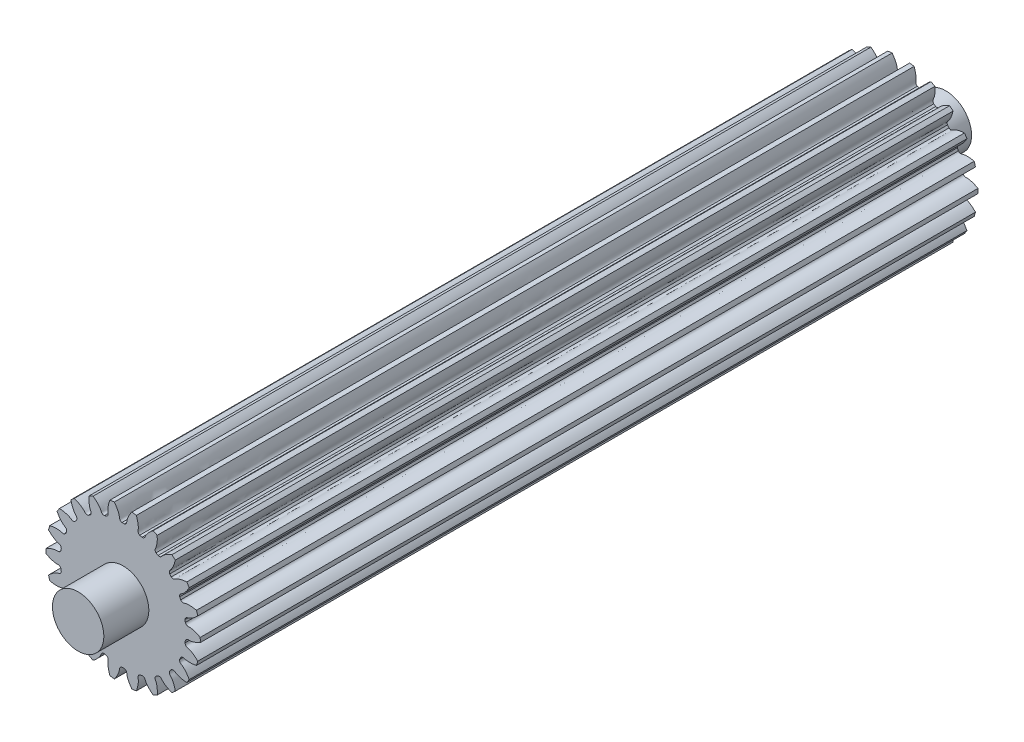
from build123d import *
from build123d.topology import SkipClean

# Parameters (mm, degrees)
SKETCH_1_R               = 12
EXTRUDE_1_DEPTH          = 30
CUT_EXTRUDE_1_DEPTH      = 35.467375879
PATTERN_CIRCULAR_1_COUNT = 22
EXTRUDE_START            = 91
EXTRUDE_2_DEPTH          = 91
SKETCH_19_R              = 4
EXTRUDE_3_DEPTH          = 7
EXTRUDE_START_2          = 7
SKETCH_20_R              = 4
EXTRUDE_4_DEPTH          = 7


with BuildPart() as part:
    # 草图1 → 凸台-拉伸1 (new body)
    with BuildSketch(Plane.XY):
        Circle(SKETCH_1_R)
    extrude(amount=EXTRUDE_1_DEPTH)

    # 草图2 → 切除-拉伸1 (cut, through all)
    with BuildSketch(Plane.XY):
        with BuildLine():
            ThreePointArc((0.185665431, 9.748232063), (0, 9.75), (-0.185665431, 9.748232063))
            add(Edge.make_bspline(
                [(-0.185665431, 9.748232063), (-0.588158706, 9.876186429), (-0.548347264, 10.151774696), (-0.599584047, 10.42157039), (-0.60596118, 10.451918903), (-0.613876897, 10.486162213), (-0.623483721, 10.524250431), (-0.634939934, 10.566127653), (-0.648399943, 10.611733662), (-0.664017171, 10.661003439), (-0.681942991, 10.713867378), (-0.70232689, 10.77025128), (-0.72531626, 10.830076418), (-0.751056303, 10.893259589), (-0.779689902, 10.959713172), (-0.811357505, 11.029345185), (-0.846197011, 11.10205935), (-0.884343649, 11.177755162), (-0.925929868, 11.25632795), (-0.971085225, 11.337668957), (-1.019936271, 11.421665408), (-1.072606448, 11.508200591), (-1.129215979, 11.597153935), (-1.189881763, 11.688401095), (-1.254717274, 11.781814033), (-1.323832459, 11.877261111), (-1.397333644, 11.974607178), (-1.475323431, 12.073713662), (-1.557900608, 12.174438668), (-1.64516006, 12.276637076), (-1.737192673, 12.380160638), (-1.834085256, 12.484858081), (-1.935920447, 12.590575215), (-2.042776642, 12.697155033), (-2.154727905, 12.804437827), (-2.271843904, 12.912261294), (-2.394189822, 13.020460649), (-2.521826308, 13.128868741), (-2.654809363, 13.237316171), (-2.841488127, 13.383435539), (-2.986445715, 13.489968103), (-3.085558798, 13.559868128)],
                knots=[0, 0, 0, 0, 0.157021319, 0.162530984, 0.168888289, 0.176093235, 0.184145822, 0.19304605, 0.202793918, 0.213389427, 0.224832576, 0.237123367, 0.250261798, 0.264247869, 0.279081582, 0.294762935, 0.311291928, 0.328668563, 0.346892838, 0.365964754, 0.38588431, 0.406651508, 0.428266346, 0.450728824, 0.474038944, 0.498196704, 0.523202104, 0.549055146, 0.575755828, 0.603304151, 0.631700114, 0.660943719, 0.691034964, 0.721973849, 0.753760376, 0.786394543, 0.819876351, 0.854205799, 0.889382888, 0.925407618, 1, 1, 1, 1], degree=3))
            ThreePointArc((-3.085558798, 13.559868128), (0, 13.906498364), (3.085558798, 13.559868128))
            add(Edge.make_bspline(
                [(0.185665431, 9.748232063), (0.588158706, 9.876186429), (0.548347264, 10.151774696), (0.599584047, 10.42157039), (0.60596118, 10.451918903), (0.613876897, 10.486162213), (0.623483721, 10.524250431), (0.634939934, 10.566127653), (0.648399943, 10.611733662), (0.664017171, 10.661003439), (0.681942991, 10.713867378), (0.70232689, 10.77025128), (0.72531626, 10.830076418), (0.751056303, 10.893259589), (0.779689902, 10.959713172), (0.811357505, 11.029345185), (0.846197011, 11.10205935), (0.884343649, 11.177755162), (0.925929868, 11.25632795), (0.971085225, 11.337668957), (1.019936271, 11.421665408), (1.072606448, 11.508200591), (1.129215979, 11.597153935), (1.189881763, 11.688401095), (1.254717274, 11.781814033), (1.323832459, 11.877261111), (1.397333644, 11.974607178), (1.475323431, 12.073713662), (1.557900608, 12.174438668), (1.64516006, 12.276637076), (1.737192673, 12.380160638), (1.834085256, 12.484858081), (1.935920447, 12.590575215), (2.042776642, 12.697155033), (2.154727905, 12.804437827), (2.271843904, 12.912261294), (2.394189822, 13.020460649), (2.521826308, 13.128868741), (2.654809363, 13.237316171), (2.841488127, 13.383435539), (2.986445715, 13.489968103), (3.085558798, 13.559868128)],
                knots=[0, 0, 0, 0, 0.157021319, 0.162530984, 0.168888289, 0.176093235, 0.184145822, 0.19304605, 0.202793918, 0.213389427, 0.224832576, 0.237123367, 0.250261798, 0.264247869, 0.279081582, 0.294762935, 0.311291928, 0.328668563, 0.346892838, 0.365964754, 0.38588431, 0.406651508, 0.428266346, 0.450728824, 0.474038944, 0.498196704, 0.523202104, 0.549055146, 0.575755828, 0.603304151, 0.631700114, 0.660943719, 0.691034964, 0.721973849, 0.753760376, 0.786394543, 0.819876351, 0.854205799, 0.889382888, 0.925407618, 1, 1, 1, 1], degree=3))
        make_face()
    cut_extrude_1 = extrude(amount=CUT_EXTRUDE_1_DEPTH, mode=Mode.SUBTRACT)

    # 阵列(圆周)1: 切除-拉伸1 ×22 about axis
    pattern_circular_1_axis = Axis((0, 0, -1.5), (0, 0, 1))
    for i in range(1, PATTERN_CIRCULAR_1_COUNT):
        add(cut_extrude_1.rotate(pattern_circular_1_axis, i * 360 / PATTERN_CIRCULAR_1_COUNT), mode=Mode.SUBTRACT)

    # 草图4 → 凸台-拉伸2 (add)
    with BuildSketch(Plane(origin=(0, 0, 0), x_dir=(-1, 0, 0), z_dir=(0, 0, -1)).offset(EXTRUDE_START)):
        with BuildLine():
            ThreePointArc((2.924539021, 9.301052173), (2.746892429, 9.355056493), (2.568249667, 9.405668166))
            add(Edge.make_bspline(
                [(2.568249667, 9.405668166), (2.218109108, 9.641834941), (2.333950094, 9.895043767), (2.361944393, 10.180005258), (2.365849304, 10.238460497), (2.368085913, 10.32113962), (2.366834845, 10.420382901), (2.360772595, 10.536017252), (2.34858845, 10.667790208), (2.32898426, 10.815370787), (2.300679804, 10.978350119), (2.26241667, 11.156242389), (2.212962422, 11.348485973), (2.151114634, 11.554444777), (2.096274933, 11.713680077), (2.062581682, 11.80433527), (2.055688884, 11.822611522)],
                knots=[0, 0, 0, 0, 0.157021319, 0.162530984, 0.176093235, 0.19304605, 0.213389427, 0.237123367, 0.264247869, 0.294762935, 0.328668563, 0.365964754, 0.406651508, 0.450728824, 0.498196704, 0.510209942, 0.510209942, 0.510209942, 0.510209942], degree=3))
            ThreePointArc((2.055688884, 11.822611522), (1.707778059, 11.877857303), (1.358395532, 11.922867171))
            add(Edge.make_bspline(
                [(1.358395532, 11.922867171), (1.300155371, 11.845656586), (1.201946581, 11.708817962), (1.073915974, 11.512256119), (0.972303664, 11.341732625), (0.885472389, 11.181826213), (0.812397844, 11.033422979), (0.752009469, 10.897343589), (0.703194045, 10.774341044), (0.670055832, 10.680054419), (0.644027119, 10.597938124), (0.627360159, 10.539619361), (0.611348785, 10.476138997), (0.60176986, 10.433080149), (0.548347264, 10.151774696), (0.588158706, 9.876186429), (0.185665431, 9.748232063)],
                knots=[0.489790058, 0.489790058, 0.489790058, 0.489790058, 0.549271176, 0.593348492, 0.634035246, 0.671331437, 0.705237065, 0.735752131, 0.762876633, 0.786610573, 0.797206082, 0.815854178, 0.823906765, 0.837469016, 0.842978681, 1, 1, 1, 1], degree=3))
            ThreePointArc((0.185665431, 9.748232063), (0, 9.75), (-0.185665431, 9.748232063))
            add(Edge.make_bspline(
                [(-0.185665431, 9.748232063), (-0.588158706, 9.876186429), (-0.548347264, 10.151774696), (-0.60176986, 10.433080149), (-0.61449187, 10.490267681), (-0.635639261, 10.570227844), (-0.664799714, 10.665098608), (-0.703194362, 10.774341023), (-0.752009695, 10.897343577), (-0.812398032, 11.033422968), (-0.885472542, 11.181826205), (-0.972303795, 11.341732617), (-1.073916075, 11.512256114), (-1.191283893, 11.692447604), (-1.288763969, 11.829782626), (-1.346632927, 11.907273161), (-1.358395532, 11.922867171)],
                knots=[0, 0, 0, 0, 0.157021319, 0.162530984, 0.176093235, 0.19304605, 0.213389427, 0.237123367, 0.264247869, 0.294762935, 0.328668563, 0.365964754, 0.406651508, 0.450728824, 0.498196704, 0.510209942, 0.510209942, 0.510209942, 0.510209942], degree=3))
            ThreePointArc((-1.358395532, 11.922867171), (-1.707778059, 11.877857303), (-2.055688884, 11.822611522))
            add(Edge.make_bspline(
                [(-2.055688884, 11.822611522), (-2.089817174, 11.732120359), (-2.145495923, 11.573156047), (-2.21296252, 11.34848595), (-2.262416797, 11.156242359), (-2.300679954, 10.978350084), (-2.328984444, 10.815370745), (-2.348588671, 10.667790156), (-2.360772906, 10.536017183), (-2.366005176, 10.436213716), (-2.36784471, 10.350090571), (-2.367406247, 10.289438503), (-2.364884562, 10.224018615), (-2.361944393, 10.180005258), (-2.333950094, 9.895043767), (-2.218109108, 9.641834941), (-2.568249667, 9.405668166)],
                knots=[0.489790058, 0.489790058, 0.489790058, 0.489790058, 0.549271176, 0.593348492, 0.634035246, 0.671331437, 0.705237065, 0.735752131, 0.762876633, 0.786610573, 0.797206082, 0.815854178, 0.823906765, 0.837469016, 0.842978681, 1, 1, 1, 1], degree=3))
            ThreePointArc((-2.568249667, 9.405668166), (-2.746892429, 9.355056493), (-2.924539021, 9.301052173))
            add(Edge.make_bspline(
                [(-2.924539021, 9.301052173), (-3.3467774, 9.310428028), (-3.386220788, 9.586069213), (-3.516732299, 9.840928935), (-3.545050567, 9.892215766), (-3.587868721, 9.962979072), (-3.642576155, 10.045791454), (-3.710192695, 10.139791761), (-3.791684488, 10.244058979), (-3.887964667, 10.357612838), (-3.999889169, 10.479417233), (-4.128253989, 10.608383121), (-4.273792278, 10.74337173), (-4.437171685, 10.883197863), (-4.569394878, 10.987506541), (-4.646751344, 11.045554595), (-4.662430821, 11.057203029)],
                knots=[0, 0, 0, 0, 0.157021319, 0.162530984, 0.176093235, 0.19304605, 0.213389427, 0.237123367, 0.264247869, 0.294762935, 0.328668563, 0.365964754, 0.406651508, 0.450728824, 0.498196704, 0.510209942, 0.510209942, 0.510209942, 0.510209942], degree=3))
            ThreePointArc((-4.662430821, 11.057203029), (-4.984980156, 10.915583944), (-5.303233613, 10.7645582))
            add(Edge.make_bspline(
                [(-5.303233613, 10.7645582), (-5.310485161, 10.668117515), (-5.319123107, 10.499905858), (-5.320559952, 10.265328941), (-5.313849705, 10.066939687), (-5.300444889, 9.885473322), (-5.281686262, 9.721121495), (-5.258918124, 9.573995807), (-5.233484075, 9.44412787), (-5.210386516, 9.346893044), (-5.187887842, 9.263740235), (-5.170379477, 9.205668531), (-5.149529026, 9.143609049), (-5.134307959, 9.102206883), (-5.027164697, 8.83667524), (-4.844678915, 8.626359328), (-5.114100451, 8.301112972)],
                knots=[0.489790058, 0.489790058, 0.489790058, 0.489790058, 0.549271176, 0.593348492, 0.634035246, 0.671331437, 0.705237065, 0.735752131, 0.762876633, 0.786610573, 0.797206082, 0.815854178, 0.823906765, 0.837469016, 0.842978681, 1, 1, 1, 1], degree=3))
            ThreePointArc((-5.114100451, 8.301112972), (-5.27124797, 8.202221945), (-5.426483851, 8.100356351))
            add(Edge.make_bspline(
                [(-5.426483851, 8.100356351), (-5.834260094, 7.99039412), (-5.949762843, 8.243757414), (-6.146790001, 8.451524185), (-6.188410351, 8.49275536), (-6.249430396, 8.548588987), (-6.325252738, 8.612634021), (-6.41661328, 8.683776874), (-6.524179553, 8.760861647), (-6.648551527, 8.842690515), (-6.790258564, 8.928028199), (-6.949757596, 9.015605514), (-7.127431248, 9.104123262), (-7.323586215, 9.192256156), (-7.479840591, 9.255088021), (-7.570417602, 9.288990887), (-7.588743694, 9.295750058)],
                knots=[0, 0, 0, 0, 0.157021319, 0.162530984, 0.176093235, 0.19304605, 0.213389427, 0.237123367, 0.264247869, 0.294762935, 0.328668563, 0.365964754, 0.406651508, 0.450728824, 0.498196704, 0.510209942, 0.510209942, 0.510209942, 0.510209942], degree=3))
            ThreePointArc((-7.588743694, 9.295750058), (-7.858328807, 9.068994892), (-8.121141894, 8.834424392))
            add(Edge.make_bspline(
                [(-8.121141894, 8.834424392), (-8.100929222, 8.739847235), (-8.061826571, 8.576015742), (-7.997117259, 8.350536032), (-7.934786112, 8.162073431), (-7.870799303, 7.991734302), (-7.806497272, 7.839324794), (-7.743201307, 7.704573257), (-7.68220949, 7.587131484), (-7.632653327, 7.500342686), (-7.587639155, 7.426896759), (-7.554479312, 7.376110043), (-7.516989274, 7.322438657), (-7.49072043, 7.287001839), (-7.313108313, 7.06241184), (-7.078761648, 6.912027385), (-7.245637231, 6.524050974)],
                knots=[0.489790058, 0.489790058, 0.489790058, 0.489790058, 0.549271176, 0.593348492, 0.634035246, 0.671331437, 0.705237065, 0.735752131, 0.762876633, 0.786610573, 0.797206082, 0.815854178, 0.823906765, 0.837469016, 0.842978681, 1, 1, 1, 1], degree=3))
            ThreePointArc((-7.245637231, 6.524050974), (-7.36855835, 6.384892156), (-7.488807233, 6.243417832))
            add(Edge.make_bspline(
                [(-7.488807233, 6.243417832), (-7.849085732, 6.023026001), (-8.031290497, 6.233585417), (-8.278871334, 6.377427208), (-8.330421932, 6.405262424), (-8.404700387, 6.441643063), (-8.495494963, 6.481732201), (-8.603198018, 6.52425403), (-8.728124391, 6.567911406), (-8.870512283, 6.611385996), (-9.030521594, 6.653343419), (-9.208233175, 6.692437167), (-9.403648127, 6.727312872), (-9.616687345, 6.756612524), (-9.784314102, 6.772877312), (-9.88077365, 6.77988838), (-9.900261685, 6.781210701)],
                knots=[0, 0, 0, 0, 0.157021319, 0.162530984, 0.176093235, 0.19304605, 0.213389427, 0.237123367, 0.264247869, 0.294762935, 0.328668563, 0.365964754, 0.406651508, 0.450728824, 0.498196704, 0.510209942, 0.510209942, 0.510209942, 0.510209942], degree=3))
            ThreePointArc((-9.900261685, 6.781210701), (-10.095042394, 6.487689809), (-10.281123557, 6.188578059))
            add(Edge.make_bspline(
                [(-10.281123557, 6.188578059), (-10.235084176, 6.103526509), (-10.151408791, 5.957347833), (-10.025795686, 5.759232356), (-9.912893339, 5.595964528), (-9.803508366, 5.450552498), (-9.698872299, 5.322432622), (-9.60017637, 5.210972003), (-9.508567979, 5.115470827), (-9.43656796, 5.046159169), (-9.372685068, 4.988370276), (-9.326560161, 4.948982987), (-9.275467756, 4.908047833), (-9.240279279, 4.881447244), (-9.006587387, 4.715993833), (-8.739365211, 4.637724091), (-8.790175575, 4.218449166)],
                knots=[0.489790058, 0.489790058, 0.489790058, 0.489790058, 0.549271176, 0.593348492, 0.634035246, 0.671331437, 0.705237065, 0.735752131, 0.762876633, 0.786610573, 0.797206082, 0.815854178, 0.823906765, 0.837469016, 0.842978681, 1, 1, 1, 1], degree=3))
            ThreePointArc((-8.790175575, 4.218449166), (-8.868911955, 4.050296377), (-8.94443199, 3.880674732))
            add(Edge.make_bspline(
                [(-8.94443199, 3.880674732), (-9.228025124, 3.567708136), (-9.462170759, 3.718405401), (-9.740247748, 3.786669007), (-9.797552271, 3.798853219), (-9.879071537, 3.812833528), (-9.97748271, 3.825718986), (-10.092802818, 3.836174925), (-10.2249685, 3.842868044), (-10.373836889, 3.844466303), (-10.53918547, 3.839644323), (-10.720712465, 3.827087362), (-10.91803736, 3.805495601), (-11.130701659, 3.773588328), (-11.296120675, 3.741968363), (-11.390648179, 3.721519639), (-11.409719353, 3.717297982)],
                knots=[0, 0, 0, 0, 0.157021319, 0.162530984, 0.176093235, 0.19304605, 0.213389427, 0.237123367, 0.264247869, 0.294762935, 0.328668563, 0.365964754, 0.406651508, 0.450728824, 0.498196704, 0.510209942, 0.510209942, 0.510209942, 0.510209942], degree=3))
            ThreePointArc((-11.409719353, 3.717297982), (-11.513915683, 3.380790682), (-11.608189734, 3.041369937))
            add(Edge.make_bspline(
                [(-11.608189734, 3.041369937), (-11.540053481, 2.972734366), (-11.418584245, 2.856051033), (-11.242243773, 2.701349926), (-11.087916901, 2.576503859), (-10.941995486, 2.467799346), (-10.805502374, 2.374348612), (-10.679402238, 2.295208787), (-10.564598841, 2.229385146), (-10.475987977, 2.183165848), (-10.398411779, 2.145715701), (-10.343058573, 2.120918762), (-10.282503004, 2.096036163), (-10.241245656, 2.080426825), (-9.970406315, 1.987514054), (-9.69195738, 1.987699973), (-9.62258617, 1.571093695)],
                knots=[0.489790058, 0.489790058, 0.489790058, 0.489790058, 0.549271176, 0.593348492, 0.634035246, 0.671331437, 0.705237065, 0.735752131, 0.762876633, 0.786610573, 0.797206082, 0.815854178, 0.823906765, 0.837469016, 0.842978681, 1, 1, 1, 1], degree=3))
            ThreePointArc((-9.62258617, 1.571093695), (-9.650759058, 1.387569673), (-9.675432062, 1.203542444))
            add(Edge.make_bspline(
                [(-9.675432062, 1.203542444), (-9.859364802, 0.823355776), (-10.126482219, 0.901982294), (-10.412527217, 0.889137403), (-10.470943193, 0.88468352), (-10.553099064, 0.875130897), (-10.651154146, 0.859768772), (-10.764748758, 0.837311742), (-10.893446471, 0.806498368), (-11.036734926, 0.766090814), (-11.194027219, 0.71488008), (-11.36466339, 0.651689699), (-11.547912138, 0.575379709), (-11.742972721, 0.484850449), (-11.892782731, 0.407907392), (-11.977720136, 0.361655509), (-11.994829415, 0.352231889)],
                knots=[0, 0, 0, 0, 0.157021319, 0.162530984, 0.176093235, 0.19304605, 0.213389427, 0.237123367, 0.264247869, 0.294762935, 0.328668563, 0.365964754, 0.406651508, 0.450728824, 0.498196704, 0.510209942, 0.510209942, 0.510209942, 0.510209942], degree=3))
            ThreePointArc((-11.994829415, 0.352231889), (-12, 0), (-11.994829415, -0.352231889))
            add(Edge.make_bspline(
                [(-11.994829415, -0.352231889), (-11.910116284, -0.398891037), (-11.760693911, -0.476626036), (-11.547912129, -0.57537981), (-11.364663379, -0.651689829), (-11.194027205, -0.714880233), (-11.03673491, -0.766091002), (-10.89344645, -0.806498594), (-10.764748734, -0.83731206), (-10.666705752, -0.856694587), (-10.58172101, -0.870771999), (-10.521623893, -0.878969688), (-10.456511011, -0.885783891), (-10.412527217, -0.889137403), (-10.126482219, -0.901982294), (-9.859364802, -0.823355776), (-9.675432062, -1.203542444)],
                knots=[0.489790058, 0.489790058, 0.489790058, 0.489790058, 0.549271176, 0.593348492, 0.634035246, 0.671331437, 0.705237065, 0.735752131, 0.762876633, 0.786610573, 0.797206082, 0.815854178, 0.823906765, 0.837469016, 0.842978681, 1, 1, 1, 1], degree=3))
            ThreePointArc((-9.675432062, -1.203542444), (-9.650759058, -1.387569673), (-9.62258617, -1.571093695))
            add(Edge.make_bspline(
                [(-9.62258617, -1.571093695), (-9.69195738, -1.987699973), (-9.970406315, -1.987514054), (-10.241245656, -2.080426825), (-10.296040571, -2.101157977), (-10.372177267, -2.133469636), (-10.461932418, -2.175834796), (-10.564598775, -2.229385458), (-10.679402194, -2.29520901), (-10.805502337, -2.374348797), (-10.941995455, -2.467799496), (-11.087916875, -2.576503987), (-11.242243753, -2.701350024), (-11.403897972, -2.843167131), (-11.52596226, -2.959199811), (-11.594428442, -3.027507799), (-11.608189734, -3.041369937)],
                knots=[0, 0, 0, 0, 0.157021319, 0.162530984, 0.176093235, 0.19304605, 0.213389427, 0.237123367, 0.264247869, 0.294762935, 0.328668563, 0.365964754, 0.406651508, 0.450728824, 0.498196704, 0.510209942, 0.510209942, 0.510209942, 0.510209942], degree=3))
            ThreePointArc((-11.608189734, -3.041369937), (-11.513915683, -3.380790682), (-11.409719353, -3.717297982))
            add(Edge.make_bspline(
                [(-11.409719353, -3.717297982), (-11.315292297, -3.73820066), (-11.150022101, -3.770689699), (-10.918037323, -3.805495695), (-10.720712418, -3.827087483), (-10.539185414, -3.839644466), (-10.373836821, -3.844466479), (-10.224968417, -3.842868255), (-10.092802706, -3.836175223), (-9.993270464, -3.827150722), (-9.907762136, -3.816714931), (-9.847789818, -3.807649241), (-9.783394683, -3.795843002), (-9.740247748, -3.786669007), (-9.462170759, -3.718405401), (-9.228025124, -3.567708136), (-8.94443199, -3.880674732)],
                knots=[0.489790058, 0.489790058, 0.489790058, 0.489790058, 0.549271176, 0.593348492, 0.634035246, 0.671331437, 0.705237065, 0.735752131, 0.762876633, 0.786610573, 0.797206082, 0.815854178, 0.823906765, 0.837469016, 0.842978681, 1, 1, 1, 1], degree=3))
            ThreePointArc((-8.94443199, -3.880674732), (-8.868911955, -4.050296377), (-8.790175575, -4.218449166))
            add(Edge.make_bspline(
                [(-8.790175575, -4.218449166), (-8.739365211, -4.637724091), (-9.006587387, -4.715993833), (-9.240279279, -4.881447244), (-9.287013975, -4.916776151), (-9.350963354, -4.969229146), (-9.425147146, -5.035165168), (-9.508567828, -5.115471107), (-9.600176265, -5.210972204), (-9.698872211, -5.322432789), (-9.803508295, -5.450552634), (-9.912893278, -5.595964644), (-10.02579564, -5.759232445), (-10.14094723, -5.940848218), (-10.225376874, -6.086570243), (-10.27182511, -6.171400431), (-10.281123557, -6.188578059)],
                knots=[0, 0, 0, 0, 0.157021319, 0.162530984, 0.176093235, 0.19304605, 0.213389427, 0.237123367, 0.264247869, 0.294762935, 0.328668563, 0.365964754, 0.406651508, 0.450728824, 0.498196704, 0.510209942, 0.510209942, 0.510209942, 0.510209942], degree=3))
            ThreePointArc((-10.281123557, -6.188578059), (-10.095042394, -6.487689809), (-9.900261685, -6.781210701))
            add(Edge.make_bspline(
                [(-9.900261685, -6.781210701), (-9.803770624, -6.774663498), (-9.636041811, -6.759274507), (-9.403648065, -6.727312951), (-9.208233095, -6.69243727), (-9.0305215, -6.65334354), (-8.870512168, -6.611386145), (-8.728124252, -6.567911585), (-8.603197826, -6.524254284), (-8.510239836, -6.487553866), (-8.431135298, -6.453450317), (-8.37614638, -6.427855698), (-8.317685902, -6.398385488), (-8.278871334, -6.377427208), (-8.031290497, -6.233585417), (-7.849085732, -6.023026001), (-7.488807233, -6.243417832)],
                knots=[0.489790058, 0.489790058, 0.489790058, 0.489790058, 0.549271176, 0.593348492, 0.634035246, 0.671331437, 0.705237065, 0.735752131, 0.762876633, 0.786610573, 0.797206082, 0.815854178, 0.823906765, 0.837469016, 0.842978681, 1, 1, 1, 1], degree=3))
            ThreePointArc((-7.488807233, -6.243417832), (-7.36855835, -6.384892156), (-7.245637231, -6.524050974))
            add(Edge.make_bspline(
                [(-7.245637231, -6.524050974), (-7.078761648, -6.912027385), (-7.313108313, -7.06241184), (-7.49072043, -7.287001839), (-7.525608738, -7.334066362), (-7.572190001, -7.402411265), (-7.624792505, -7.486576403), (-7.682209266, -7.58713171), (-7.743201149, -7.70457342), (-7.80649714, -7.83932493), (-7.870799196, -7.991734412), (-7.934786021, -8.162073525), (-7.997117189, -8.350536104), (-8.056437255, -8.557237115), (-8.096392266, -8.720842953), (-8.117059596, -8.815322902), (-8.121141894, -8.834424392)],
                knots=[0, 0, 0, 0, 0.157021319, 0.162530984, 0.176093235, 0.19304605, 0.213389427, 0.237123367, 0.264247869, 0.294762935, 0.328668563, 0.365964754, 0.406651508, 0.450728824, 0.498196704, 0.510209942, 0.510209942, 0.510209942, 0.510209942], degree=3))
            ThreePointArc((-8.121141894, -8.834424392), (-7.858328807, -9.068994892), (-7.588743694, -9.295750058))
            add(Edge.make_bspline(
                [(-7.588743694, -9.295750058), (-7.498005759, -9.262283389), (-7.341406722, -9.200263094), (-7.127431166, -9.104123321), (-6.94975749, -9.015605591), (-6.79025844, -8.928028289), (-6.648551375, -8.842690626), (-6.524179369, -8.760861779), (-6.416613024, -8.683777064), (-6.337760188, -8.622373978), (-6.271468019, -8.56736554), (-6.225917377, -8.527315513), (-6.178127677, -8.482568835), (-6.146790001, -8.451524185), (-5.949762843, -8.243757414), (-5.834260094, -7.99039412), (-5.426483851, -8.100356351)],
                knots=[0.489790058, 0.489790058, 0.489790058, 0.489790058, 0.549271176, 0.593348492, 0.634035246, 0.671331437, 0.705237065, 0.735752131, 0.762876633, 0.786610573, 0.797206082, 0.815854178, 0.823906765, 0.837469016, 0.842978681, 1, 1, 1, 1], degree=3))
            ThreePointArc((-5.426483851, -8.100356351), (-5.27124797, -8.202221945), (-5.114100451, -8.301112972))
            add(Edge.make_bspline(
                [(-5.114100451, -8.301112972), (-4.844678915, -8.626359328), (-5.027164697, -8.83667524), (-5.134307959, -9.102206883), (-5.154523438, -9.157194134), (-5.179962849, -9.235894046), (-5.206722521, -9.331469743), (-5.233483796, -9.444128024), (-5.258917927, -9.573995919), (-5.281686098, -9.721121587), (-5.300444756, -9.885473397), (-5.313849591, -10.066939751), (-5.320559864, -10.265328991), (-5.319242647, -10.480369552), (-5.311486107, -10.648604832), (-5.304698188, -10.745080339), (-5.303233613, -10.7645582)],
                knots=[0, 0, 0, 0, 0.157021319, 0.162530984, 0.176093235, 0.19304605, 0.213389427, 0.237123367, 0.264247869, 0.294762935, 0.328668563, 0.365964754, 0.406651508, 0.450728824, 0.498196704, 0.510209942, 0.510209942, 0.510209942, 0.510209942], degree=3))
            ThreePointArc((-5.303233613, -10.7645582), (-4.984980156, -10.915583944), (-4.662430821, -11.057203029))
            add(Edge.make_bspline(
                [(-4.662430821, -11.057203029), (-4.584797061, -10.999528165), (-4.452014522, -10.89590108), (-4.273792183, -10.743371764), (-4.128253866, -10.608383165), (-3.999889025, -10.479417284), (-3.887964489, -10.357612901), (-3.791684274, -10.244059055), (-3.710192396, -10.139791871), (-3.651832902, -10.05866063), (-3.6037237, -9.987203758), (-3.571301575, -9.93594294), (-3.538054289, -9.879544902), (-3.516732299, -9.840928935), (-3.386220788, -9.586069213), (-3.3467774, -9.310428028), (-2.924539021, -9.301052173)],
                knots=[0.489790058, 0.489790058, 0.489790058, 0.489790058, 0.549271176, 0.593348492, 0.634035246, 0.671331437, 0.705237065, 0.735752131, 0.762876633, 0.786610573, 0.797206082, 0.815854178, 0.823906765, 0.837469016, 0.842978681, 1, 1, 1, 1], degree=3))
            ThreePointArc((-2.924539021, -9.301052173), (-2.746892429, -9.355056493), (-2.568249667, -9.405668166))
            add(Edge.make_bspline(
                [(-2.568249667, -9.405668166), (-2.218109108, -9.641834941), (-2.333950094, -9.895043767), (-2.361944393, -10.180005258), (-2.365849304, -10.238460497), (-2.368085913, -10.32113962), (-2.366834845, -10.420382901), (-2.360772595, -10.536017252), (-2.34858845, -10.667790208), (-2.32898426, -10.815370787), (-2.300679804, -10.978350119), (-2.26241667, -11.156242389), (-2.212962422, -11.348485973), (-2.151114634, -11.554444777), (-2.096274933, -11.713680077), (-2.062581682, -11.80433527), (-2.055688884, -11.822611522)],
                knots=[0, 0, 0, 0, 0.157021319, 0.162530984, 0.176093235, 0.19304605, 0.213389427, 0.237123367, 0.264247869, 0.294762935, 0.328668563, 0.365964754, 0.406651508, 0.450728824, 0.498196704, 0.510209942, 0.510209942, 0.510209942, 0.510209942], degree=3))
            ThreePointArc((-2.055688884, -11.822611522), (-1.707778059, -11.877857303), (-1.358395532, -11.922867171))
            add(Edge.make_bspline(
                [(-1.358395532, -11.922867171), (-1.300155371, -11.845656586), (-1.201946581, -11.708817962), (-1.073915974, -11.512256119), (-0.972303664, -11.341732625), (-0.885472389, -11.181826213), (-0.812397844, -11.033422979), (-0.752009469, -10.897343589), (-0.703194045, -10.774341044), (-0.670055832, -10.680054419), (-0.644027119, -10.597938124), (-0.627360159, -10.539619361), (-0.611348785, -10.476138997), (-0.60176986, -10.433080149), (-0.548347264, -10.151774696), (-0.588158706, -9.876186429), (-0.185665431, -9.748232063)],
                knots=[0.489790058, 0.489790058, 0.489790058, 0.489790058, 0.549271176, 0.593348492, 0.634035246, 0.671331437, 0.705237065, 0.735752131, 0.762876633, 0.786610573, 0.797206082, 0.815854178, 0.823906765, 0.837469016, 0.842978681, 1, 1, 1, 1], degree=3))
            ThreePointArc((-0.185665431, -9.748232063), (0, -9.75), (0.185665431, -9.748232063))
            add(Edge.make_bspline(
                [(0.185665431, -9.748232063), (0.588158706, -9.876186429), (0.548347264, -10.151774696), (0.60176986, -10.433080149), (0.61449187, -10.490267681), (0.635639261, -10.570227844), (0.664799714, -10.665098608), (0.703194362, -10.774341023), (0.752009695, -10.897343577), (0.812398032, -11.033422968), (0.885472542, -11.181826205), (0.972303795, -11.341732617), (1.073916075, -11.512256114), (1.191283893, -11.692447604), (1.288763969, -11.829782626), (1.346632927, -11.907273161), (1.358395532, -11.922867171)],
                knots=[0, 0, 0, 0, 0.157021319, 0.162530984, 0.176093235, 0.19304605, 0.213389427, 0.237123367, 0.264247869, 0.294762935, 0.328668563, 0.365964754, 0.406651508, 0.450728824, 0.498196704, 0.510209942, 0.510209942, 0.510209942, 0.510209942], degree=3))
            ThreePointArc((1.358395532, -11.922867171), (1.707778059, -11.877857303), (2.055688884, -11.822611522))
            add(Edge.make_bspline(
                [(2.055688884, -11.822611522), (2.089817174, -11.732120359), (2.145495923, -11.573156047), (2.21296252, -11.34848595), (2.262416797, -11.156242359), (2.300679954, -10.978350084), (2.328984444, -10.815370745), (2.348588671, -10.667790156), (2.360772906, -10.536017183), (2.366005176, -10.436213716), (2.36784471, -10.350090571), (2.367406247, -10.289438503), (2.364884562, -10.224018615), (2.361944393, -10.180005258), (2.333950094, -9.895043767), (2.218109108, -9.641834941), (2.568249667, -9.405668166)],
                knots=[0.489790058, 0.489790058, 0.489790058, 0.489790058, 0.549271176, 0.593348492, 0.634035246, 0.671331437, 0.705237065, 0.735752131, 0.762876633, 0.786610573, 0.797206082, 0.815854178, 0.823906765, 0.837469016, 0.842978681, 1, 1, 1, 1], degree=3))
            ThreePointArc((2.568249667, -9.405668166), (2.746892429, -9.355056493), (2.924539021, -9.301052173))
            add(Edge.make_bspline(
                [(2.924539021, -9.301052173), (3.3467774, -9.310428028), (3.386220788, -9.586069213), (3.516732299, -9.840928935), (3.545050567, -9.892215766), (3.587868721, -9.962979072), (3.642576155, -10.045791454), (3.710192695, -10.139791761), (3.791684488, -10.244058979), (3.887964667, -10.357612838), (3.999889169, -10.479417233), (4.128253989, -10.608383121), (4.273792278, -10.74337173), (4.437171685, -10.883197863), (4.569394878, -10.987506541), (4.646751344, -11.045554595), (4.662430821, -11.057203029)],
                knots=[0, 0, 0, 0, 0.157021319, 0.162530984, 0.176093235, 0.19304605, 0.213389427, 0.237123367, 0.264247869, 0.294762935, 0.328668563, 0.365964754, 0.406651508, 0.450728824, 0.498196704, 0.510209942, 0.510209942, 0.510209942, 0.510209942], degree=3))
            ThreePointArc((4.662430821, -11.057203029), (4.984980156, -10.915583944), (5.303233613, -10.7645582))
            add(Edge.make_bspline(
                [(5.303233613, -10.7645582), (5.310485161, -10.668117515), (5.319123107, -10.499905858), (5.320559952, -10.265328941), (5.313849705, -10.066939687), (5.300444889, -9.885473322), (5.281686262, -9.721121495), (5.258918124, -9.573995807), (5.233484075, -9.44412787), (5.210386516, -9.346893044), (5.187887842, -9.263740235), (5.170379477, -9.205668531), (5.149529026, -9.143609049), (5.134307959, -9.102206883), (5.027164697, -8.83667524), (4.844678915, -8.626359328), (5.114100451, -8.301112972)],
                knots=[0.489790058, 0.489790058, 0.489790058, 0.489790058, 0.549271176, 0.593348492, 0.634035246, 0.671331437, 0.705237065, 0.735752131, 0.762876633, 0.786610573, 0.797206082, 0.815854178, 0.823906765, 0.837469016, 0.842978681, 1, 1, 1, 1], degree=3))
            ThreePointArc((5.114100451, -8.301112972), (5.27124797, -8.202221945), (5.426483851, -8.100356351))
            add(Edge.make_bspline(
                [(5.426483851, -8.100356351), (5.834260094, -7.99039412), (5.949762843, -8.243757414), (6.146790001, -8.451524185), (6.188410351, -8.49275536), (6.249430396, -8.548588987), (6.325252738, -8.612634021), (6.41661328, -8.683776874), (6.524179553, -8.760861647), (6.648551527, -8.842690515), (6.790258564, -8.928028199), (6.949757596, -9.015605514), (7.127431248, -9.104123262), (7.323586215, -9.192256156), (7.479840591, -9.255088021), (7.570417602, -9.288990887), (7.588743694, -9.295750058)],
                knots=[0, 0, 0, 0, 0.157021319, 0.162530984, 0.176093235, 0.19304605, 0.213389427, 0.237123367, 0.264247869, 0.294762935, 0.328668563, 0.365964754, 0.406651508, 0.450728824, 0.498196704, 0.510209942, 0.510209942, 0.510209942, 0.510209942], degree=3))
            ThreePointArc((7.588743694, -9.295750058), (7.858328807, -9.068994892), (8.121141894, -8.834424392))
            add(Edge.make_bspline(
                [(8.121141894, -8.834424392), (8.100929222, -8.739847235), (8.061826571, -8.576015742), (7.997117259, -8.350536032), (7.934786112, -8.162073431), (7.870799303, -7.991734302), (7.806497272, -7.839324794), (7.743201307, -7.704573257), (7.68220949, -7.587131484), (7.632653327, -7.500342686), (7.587639155, -7.426896759), (7.554479312, -7.376110043), (7.516989274, -7.322438657), (7.49072043, -7.287001839), (7.313108313, -7.06241184), (7.078761648, -6.912027385), (7.245637231, -6.524050974)],
                knots=[0.489790058, 0.489790058, 0.489790058, 0.489790058, 0.549271176, 0.593348492, 0.634035246, 0.671331437, 0.705237065, 0.735752131, 0.762876633, 0.786610573, 0.797206082, 0.815854178, 0.823906765, 0.837469016, 0.842978681, 1, 1, 1, 1], degree=3))
            ThreePointArc((7.245637231, -6.524050974), (7.36855835, -6.384892156), (7.488807233, -6.243417832))
            add(Edge.make_bspline(
                [(7.488807233, -6.243417832), (7.849085732, -6.023026001), (8.031290497, -6.233585417), (8.278871334, -6.377427208), (8.330421932, -6.405262424), (8.404700387, -6.441643063), (8.495494963, -6.481732201), (8.603198018, -6.52425403), (8.728124391, -6.567911406), (8.870512283, -6.611385996), (9.030521594, -6.653343419), (9.208233175, -6.692437167), (9.403648127, -6.727312872), (9.616687345, -6.756612524), (9.784314102, -6.772877312), (9.88077365, -6.77988838), (9.900261685, -6.781210701)],
                knots=[0, 0, 0, 0, 0.157021319, 0.162530984, 0.176093235, 0.19304605, 0.213389427, 0.237123367, 0.264247869, 0.294762935, 0.328668563, 0.365964754, 0.406651508, 0.450728824, 0.498196704, 0.510209942, 0.510209942, 0.510209942, 0.510209942], degree=3))
            ThreePointArc((9.900261685, -6.781210701), (10.095042394, -6.487689809), (10.281123557, -6.188578059))
            add(Edge.make_bspline(
                [(10.281123557, -6.188578059), (10.235084176, -6.103526509), (10.151408791, -5.957347833), (10.025795686, -5.759232356), (9.912893339, -5.595964528), (9.803508366, -5.450552498), (9.698872299, -5.322432622), (9.60017637, -5.210972003), (9.508567979, -5.115470827), (9.43656796, -5.046159169), (9.372685068, -4.988370276), (9.326560161, -4.948982987), (9.275467756, -4.908047833), (9.240279279, -4.881447244), (9.006587387, -4.715993833), (8.739365211, -4.637724091), (8.790175575, -4.218449166)],
                knots=[0.489790058, 0.489790058, 0.489790058, 0.489790058, 0.549271176, 0.593348492, 0.634035246, 0.671331437, 0.705237065, 0.735752131, 0.762876633, 0.786610573, 0.797206082, 0.815854178, 0.823906765, 0.837469016, 0.842978681, 1, 1, 1, 1], degree=3))
            ThreePointArc((8.790175575, -4.218449166), (8.868911955, -4.050296377), (8.94443199, -3.880674732))
            add(Edge.make_bspline(
                [(8.94443199, -3.880674732), (9.228025124, -3.567708136), (9.462170759, -3.718405401), (9.740247748, -3.786669007), (9.797552271, -3.798853219), (9.879071537, -3.812833528), (9.97748271, -3.825718986), (10.092802818, -3.836174925), (10.2249685, -3.842868044), (10.373836889, -3.844466303), (10.53918547, -3.839644323), (10.720712465, -3.827087362), (10.91803736, -3.805495601), (11.130701659, -3.773588328), (11.296120675, -3.741968363), (11.390648179, -3.721519639), (11.409719353, -3.717297982)],
                knots=[0, 0, 0, 0, 0.157021319, 0.162530984, 0.176093235, 0.19304605, 0.213389427, 0.237123367, 0.264247869, 0.294762935, 0.328668563, 0.365964754, 0.406651508, 0.450728824, 0.498196704, 0.510209942, 0.510209942, 0.510209942, 0.510209942], degree=3))
            ThreePointArc((11.409719353, -3.717297982), (11.513915683, -3.380790682), (11.608189734, -3.041369937))
            add(Edge.make_bspline(
                [(11.608189734, -3.041369937), (11.540053481, -2.972734366), (11.418584245, -2.856051033), (11.242243773, -2.701349926), (11.087916901, -2.576503859), (10.941995486, -2.467799346), (10.805502374, -2.374348612), (10.679402238, -2.295208787), (10.564598841, -2.229385146), (10.475987977, -2.183165848), (10.398411779, -2.145715701), (10.343058573, -2.120918762), (10.282503004, -2.096036163), (10.241245656, -2.080426825), (9.970406315, -1.987514054), (9.69195738, -1.987699973), (9.62258617, -1.571093695)],
                knots=[0.489790058, 0.489790058, 0.489790058, 0.489790058, 0.549271176, 0.593348492, 0.634035246, 0.671331437, 0.705237065, 0.735752131, 0.762876633, 0.786610573, 0.797206082, 0.815854178, 0.823906765, 0.837469016, 0.842978681, 1, 1, 1, 1], degree=3))
            ThreePointArc((9.62258617, -1.571093695), (9.650759058, -1.387569673), (9.675432062, -1.203542444))
            add(Edge.make_bspline(
                [(9.675432062, -1.203542444), (9.859364802, -0.823355776), (10.126482219, -0.901982294), (10.412527217, -0.889137403), (10.470943193, -0.88468352), (10.553099064, -0.875130897), (10.651154146, -0.859768772), (10.764748758, -0.837311742), (10.893446471, -0.806498368), (11.036734926, -0.766090814), (11.194027219, -0.71488008), (11.36466339, -0.651689699), (11.547912138, -0.575379709), (11.742972721, -0.484850449), (11.892782731, -0.407907392), (11.977720136, -0.361655509), (11.994829415, -0.352231889)],
                knots=[0, 0, 0, 0, 0.157021319, 0.162530984, 0.176093235, 0.19304605, 0.213389427, 0.237123367, 0.264247869, 0.294762935, 0.328668563, 0.365964754, 0.406651508, 0.450728824, 0.498196704, 0.510209942, 0.510209942, 0.510209942, 0.510209942], degree=3))
            ThreePointArc((11.994829415, -0.352231889), (12, 0), (11.994829415, 0.352231889))
            add(Edge.make_bspline(
                [(11.994829415, 0.352231889), (11.910116284, 0.398891037), (11.760693911, 0.476626036), (11.547912129, 0.57537981), (11.364663379, 0.651689829), (11.194027205, 0.714880233), (11.03673491, 0.766091002), (10.89344645, 0.806498594), (10.764748734, 0.83731206), (10.666705752, 0.856694587), (10.58172101, 0.870771999), (10.521623893, 0.878969688), (10.456511011, 0.885783891), (10.412527217, 0.889137403), (10.126482219, 0.901982294), (9.859364802, 0.823355776), (9.675432062, 1.203542444)],
                knots=[0.489790058, 0.489790058, 0.489790058, 0.489790058, 0.549271176, 0.593348492, 0.634035246, 0.671331437, 0.705237065, 0.735752131, 0.762876633, 0.786610573, 0.797206082, 0.815854178, 0.823906765, 0.837469016, 0.842978681, 1, 1, 1, 1], degree=3))
            ThreePointArc((9.675432062, 1.203542444), (9.650759058, 1.387569673), (9.62258617, 1.571093695))
            add(Edge.make_bspline(
                [(9.62258617, 1.571093695), (9.69195738, 1.987699973), (9.970406315, 1.987514054), (10.241245656, 2.080426825), (10.296040571, 2.101157977), (10.372177267, 2.133469636), (10.461932418, 2.175834796), (10.564598775, 2.229385458), (10.679402194, 2.29520901), (10.805502337, 2.374348797), (10.941995455, 2.467799496), (11.087916875, 2.576503987), (11.242243753, 2.701350024), (11.403897972, 2.843167131), (11.52596226, 2.959199811), (11.594428442, 3.027507799), (11.608189734, 3.041369937)],
                knots=[0, 0, 0, 0, 0.157021319, 0.162530984, 0.176093235, 0.19304605, 0.213389427, 0.237123367, 0.264247869, 0.294762935, 0.328668563, 0.365964754, 0.406651508, 0.450728824, 0.498196704, 0.510209942, 0.510209942, 0.510209942, 0.510209942], degree=3))
            ThreePointArc((11.608189734, 3.041369937), (11.513915683, 3.380790682), (11.409719353, 3.717297982))
            add(Edge.make_bspline(
                [(11.409719353, 3.717297982), (11.315292297, 3.73820066), (11.150022101, 3.770689699), (10.918037323, 3.805495695), (10.720712418, 3.827087483), (10.539185414, 3.839644466), (10.373836821, 3.844466479), (10.224968417, 3.842868255), (10.092802706, 3.836175223), (9.993270464, 3.827150722), (9.907762136, 3.816714931), (9.847789818, 3.807649241), (9.783394683, 3.795843002), (9.740247748, 3.786669007), (9.462170759, 3.718405401), (9.228025124, 3.567708136), (8.94443199, 3.880674732)],
                knots=[0.489790058, 0.489790058, 0.489790058, 0.489790058, 0.549271176, 0.593348492, 0.634035246, 0.671331437, 0.705237065, 0.735752131, 0.762876633, 0.786610573, 0.797206082, 0.815854178, 0.823906765, 0.837469016, 0.842978681, 1, 1, 1, 1], degree=3))
            ThreePointArc((8.94443199, 3.880674732), (8.868911955, 4.050296377), (8.790175575, 4.218449166))
            add(Edge.make_bspline(
                [(8.790175575, 4.218449166), (8.739365211, 4.637724091), (9.006587387, 4.715993833), (9.240279279, 4.881447244), (9.287013975, 4.916776151), (9.350963354, 4.969229146), (9.425147146, 5.035165168), (9.508567828, 5.115471107), (9.600176265, 5.210972204), (9.698872211, 5.322432789), (9.803508295, 5.450552634), (9.912893278, 5.595964644), (10.02579564, 5.759232445), (10.14094723, 5.940848218), (10.225376874, 6.086570243), (10.27182511, 6.171400431), (10.281123557, 6.188578059)],
                knots=[0, 0, 0, 0, 0.157021319, 0.162530984, 0.176093235, 0.19304605, 0.213389427, 0.237123367, 0.264247869, 0.294762935, 0.328668563, 0.365964754, 0.406651508, 0.450728824, 0.498196704, 0.510209942, 0.510209942, 0.510209942, 0.510209942], degree=3))
            ThreePointArc((10.281123557, 6.188578059), (10.095042394, 6.487689809), (9.900261685, 6.781210701))
            add(Edge.make_bspline(
                [(9.900261685, 6.781210701), (9.803770624, 6.774663498), (9.636041811, 6.759274507), (9.403648065, 6.727312951), (9.208233095, 6.69243727), (9.0305215, 6.65334354), (8.870512168, 6.611386145), (8.728124252, 6.567911585), (8.603197826, 6.524254284), (8.510239836, 6.487553866), (8.431135298, 6.453450317), (8.37614638, 6.427855698), (8.317685902, 6.398385488), (8.278871334, 6.377427208), (8.031290497, 6.233585417), (7.849085732, 6.023026001), (7.488807233, 6.243417832)],
                knots=[0.489790058, 0.489790058, 0.489790058, 0.489790058, 0.549271176, 0.593348492, 0.634035246, 0.671331437, 0.705237065, 0.735752131, 0.762876633, 0.786610573, 0.797206082, 0.815854178, 0.823906765, 0.837469016, 0.842978681, 1, 1, 1, 1], degree=3))
            ThreePointArc((7.488807233, 6.243417832), (7.36855835, 6.384892156), (7.245637231, 6.524050974))
            add(Edge.make_bspline(
                [(7.245637231, 6.524050974), (7.078761648, 6.912027385), (7.313108313, 7.06241184), (7.49072043, 7.287001839), (7.525608738, 7.334066362), (7.572190001, 7.402411265), (7.624792505, 7.486576403), (7.682209266, 7.58713171), (7.743201149, 7.70457342), (7.80649714, 7.83932493), (7.870799196, 7.991734412), (7.934786021, 8.162073525), (7.997117189, 8.350536104), (8.056437255, 8.557237115), (8.096392266, 8.720842953), (8.117059596, 8.815322902), (8.121141894, 8.834424392)],
                knots=[0, 0, 0, 0, 0.157021319, 0.162530984, 0.176093235, 0.19304605, 0.213389427, 0.237123367, 0.264247869, 0.294762935, 0.328668563, 0.365964754, 0.406651508, 0.450728824, 0.498196704, 0.510209942, 0.510209942, 0.510209942, 0.510209942], degree=3))
            ThreePointArc((8.121141894, 8.834424392), (7.858328807, 9.068994892), (7.588743694, 9.295750058))
            add(Edge.make_bspline(
                [(7.588743694, 9.295750058), (7.498005759, 9.262283389), (7.341406722, 9.200263094), (7.127431166, 9.104123321), (6.94975749, 9.015605591), (6.79025844, 8.928028289), (6.648551375, 8.842690626), (6.524179369, 8.760861779), (6.416613024, 8.683777064), (6.337760188, 8.622373978), (6.271468019, 8.56736554), (6.225917377, 8.527315513), (6.178127677, 8.482568835), (6.146790001, 8.451524185), (5.949762843, 8.243757414), (5.834260094, 7.99039412), (5.426483851, 8.100356351)],
                knots=[0.489790058, 0.489790058, 0.489790058, 0.489790058, 0.549271176, 0.593348492, 0.634035246, 0.671331437, 0.705237065, 0.735752131, 0.762876633, 0.786610573, 0.797206082, 0.815854178, 0.823906765, 0.837469016, 0.842978681, 1, 1, 1, 1], degree=3))
            ThreePointArc((5.426483851, 8.100356351), (5.27124797, 8.202221945), (5.114100451, 8.301112972))
            add(Edge.make_bspline(
                [(5.114100451, 8.301112972), (4.844678915, 8.626359328), (5.027164697, 8.83667524), (5.134307959, 9.102206883), (5.154523438, 9.157194134), (5.179962849, 9.235894046), (5.206722521, 9.331469743), (5.233483796, 9.444128024), (5.258917927, 9.573995919), (5.281686098, 9.721121587), (5.300444756, 9.885473397), (5.313849591, 10.066939751), (5.320559864, 10.265328991), (5.319242647, 10.480369552), (5.311486107, 10.648604832), (5.304698188, 10.745080339), (5.303233613, 10.7645582)],
                knots=[0, 0, 0, 0, 0.157021319, 0.162530984, 0.176093235, 0.19304605, 0.213389427, 0.237123367, 0.264247869, 0.294762935, 0.328668563, 0.365964754, 0.406651508, 0.450728824, 0.498196704, 0.510209942, 0.510209942, 0.510209942, 0.510209942], degree=3))
            ThreePointArc((5.303233613, 10.7645582), (4.984980156, 10.915583944), (4.662430821, 11.057203029))
            add(Edge.make_bspline(
                [(4.662430821, 11.057203029), (4.584797061, 10.999528165), (4.452014522, 10.89590108), (4.273792183, 10.743371764), (4.128253866, 10.608383165), (3.999889025, 10.479417284), (3.887964489, 10.357612901), (3.791684274, 10.244059055), (3.710192396, 10.139791871), (3.651832902, 10.05866063), (3.6037237, 9.987203758), (3.571301575, 9.93594294), (3.538054289, 9.879544902), (3.516732299, 9.840928935), (3.386220788, 9.586069213), (3.3467774, 9.310428028), (2.924539021, 9.301052173)],
                knots=[0.489790058, 0.489790058, 0.489790058, 0.489790058, 0.549271176, 0.593348492, 0.634035246, 0.671331437, 0.705237065, 0.735752131, 0.762876633, 0.786610573, 0.797206082, 0.815854178, 0.823906765, 0.837469016, 0.842978681, 1, 1, 1, 1], degree=3))
        make_face()
    extrude(amount=-EXTRUDE_2_DEPTH)

    # 草图19 → 凸台-拉伸3 (add)
    with SkipClean():  # the faces are left unmerged after this step: merging them gives an invalid solid
        with BuildSketch(Plane(origin=(0, 0, -91), x_dir=(-1, 0, 0), z_dir=(0, 0, -1))):
            Circle(SKETCH_19_R)
        extrude(amount=EXTRUDE_3_DEPTH)

    # 草图20 → 凸台-拉伸4 (add)
    with SkipClean():  # the faces are left unmerged after this step: merging them gives an invalid solid
        with BuildSketch(Plane.XY.offset(30).offset(EXTRUDE_START_2)):
            Circle(SKETCH_20_R)
        extrude(amount=-EXTRUDE_4_DEPTH)


solid = part.part
